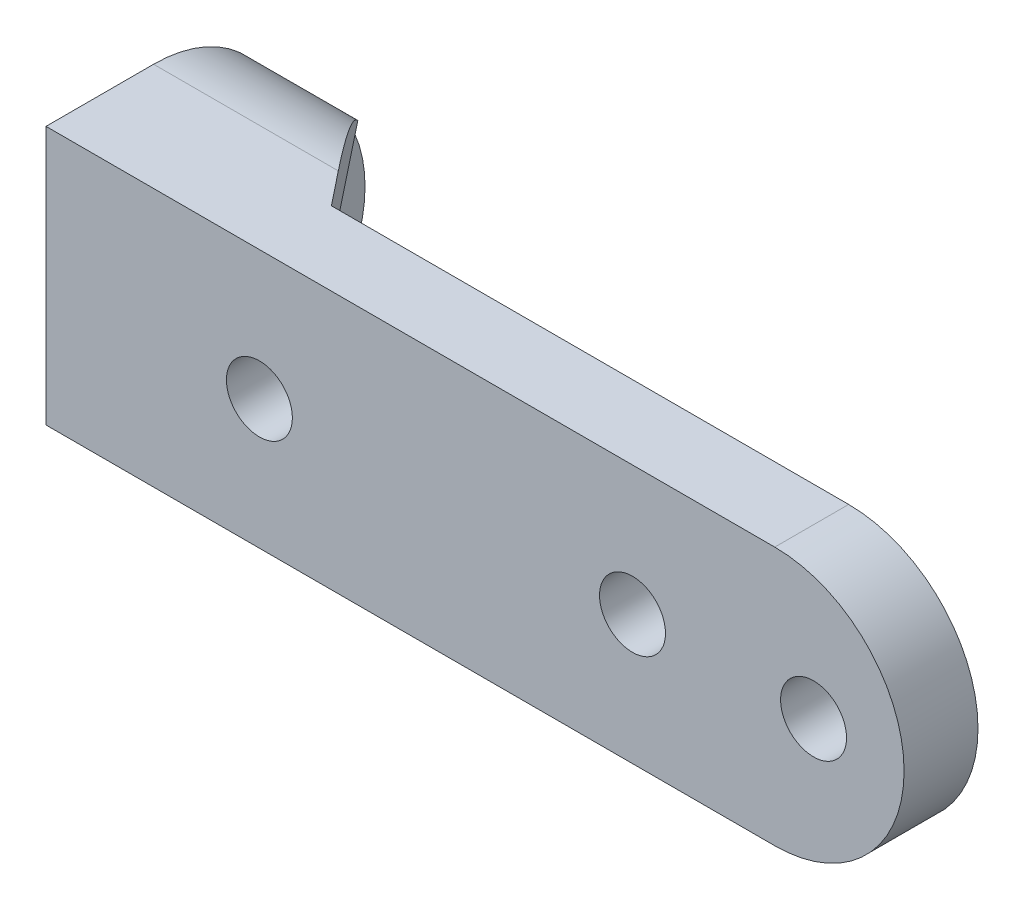
from build123d import *

# Parameters (mm, degrees)
BOSS_EXTRUDE1_DEPTH     = 2.8575
CUT_EXTRUDE1_DEPTH      = 33.135046678
CUT_EXTRUDE1_DEPTH_BACK = 33.135046678
SKETCH3_R               = 2.55
SKETCH4_R               = 2.55
CUT_EXTRUDE2_DEPTH      = 5.715
SKETCH5_W               = 18.318839082
SKETCH5_H               = 20
BOSS_EXTRUDE2_DEPTH     = 6.35
FILLET1_R               = 10
CUT_EXTRUDE3_DEPTH      = 69.857646679
CUT_EXTRUDE3_DEPTH_BACK = 69.857646679
SKETCH6_R               = 2.55
BOSS_EXTRUDE3_DEPTH     = 3.175
CUT_EXTRUDE4_DEPTH      = 69.857646679
CUT_EXTRUDE4_DEPTH_BACK = 69.857646679
FILLET2_R               = 2


with BuildPart() as part:
    # Sketch2 → Boss-Extrude1 (new, symmetric)
    with BuildSketch(Plane.XY):
        with BuildLine():
            Line((-30, 10), (-30, -10))
            Line((-30, -10), (20, -10))
            ThreePointArc((20, -10), (30, 0), (20, 10))
            Line((20, 10), (-30, 10))
        make_face()
    extrude(amount=BOSS_EXTRUDE1_DEPTH, both=True)

    # Sketch3 → Cut-Extrude1 (cut, two sides: drawn at the far end of the back side and taken through both)
    with BuildSketch(Plane.XY.offset(2.8575).offset(-CUT_EXTRUDE1_DEPTH_BACK)):
        with Locations((9, 0)):
            Circle(SKETCH3_R)
        with Locations((23, 0)):
            Circle(SKETCH3_R)
    extrude(amount=CUT_EXTRUDE1_DEPTH + CUT_EXTRUDE1_DEPTH_BACK, mode=Mode.SUBTRACT)

    # Sketch4 → Cut-Extrude2 (cut)
    with BuildSketch(Plane.XY.offset(2.8575)):
        with Locations((-19.85, 0)):
            Circle(SKETCH4_R)
    extrude(amount=-CUT_EXTRUDE2_DEPTH, mode=Mode.SUBTRACT)

    # Sketch5 → Boss-Extrude2 (add)
    with BuildSketch(Plane.ZY.offset(30)):
        with Locations((-6.301919541, 0)):
            Rectangle(SKETCH5_W, SKETCH5_H)
    extrude(amount=BOSS_EXTRUDE2_DEPTH)

    # Fillet1
    fillet1_edges = [part.edges().sort_by_distance(p)[0] for p in [
        (-33.175, -10, -15.461339082),
        (-33.175, 10, -15.461339082),
    ]]
    fillet(fillet1_edges, radius=FILLET1_R - 0.0001)  # a hair under: the kernel refuses the full size

    # Sketch6 → Cut-Extrude3 (cut, two sides: drawn at the far end of the back side and taken through both)
    with BuildSketch(Plane.ZY.offset(36.35).offset(-CUT_EXTRUDE3_DEPTH_BACK)):
        with Locations(Location((-9.1425, 0, 0), (0, 0, 90))):
            Circle(SKETCH6_R)
    extrude(amount=CUT_EXTRUDE3_DEPTH + CUT_EXTRUDE3_DEPTH_BACK, mode=Mode.SUBTRACT)

    # Sketch7 → Boss-Extrude3 (add)
    with BuildSketch(Plane(origin=(0, 10, 0), x_dir=(1, 0, 0), z_dir=(0, 1, 0))):
        Polygon((-30, 2.8575), (-20, 2.8575), (-30, 15.461339082), (-30, 5.461339082), align=None)
    boss_extrude3 = extrude(amount=-BOSS_EXTRUDE3_DEPTH)

    # Mirror1: Boss-Extrude3 across plane
    add(boss_extrude3.mirror(Plane.ZX))

    # Sketch8 → Cut-Extrude4 (cut, two sides: drawn at the far end of the back side and taken through both)
    with BuildSketch(Plane.ZY.offset(36.35).offset(-CUT_EXTRUDE4_DEPTH_BACK)):
        with BuildLine():
            ThreePointArc((-15.461339082, 0), (-12.532406894, 7.071067812), (-5.461339082, 10))
            Line((-5.461339082, 10), (-15.461339082, 10))
            Line((-15.461339082, 10), (-15.461339082, 0))
        make_face()
        with BuildLine():
            Line((-15.461339082, -10), (-5.461339082, -10))
            ThreePointArc((-5.461339082, -10), (-12.532406894, -7.071067812), (-15.461339082, 0))
            Line((-15.461339082, 0), (-15.461339082, -10))
        make_face()
    extrude(amount=CUT_EXTRUDE4_DEPTH + CUT_EXTRUDE4_DEPTH_BACK, mode=Mode.SUBTRACT)

    # Fillet2
    fillet2_edges = [part.edges().sort_by_distance(p)[0] for p in [
        (-30, 0, -2.8575),
        (-30, 6.825, -7.813847506),
        (-25, 6.825, -2.8575),
        (-30, -6.825, -7.813847506),
        (-25, -6.825, -2.8575),
    ]]
    fillet(fillet2_edges, radius=FILLET2_R)


solid = part.part
